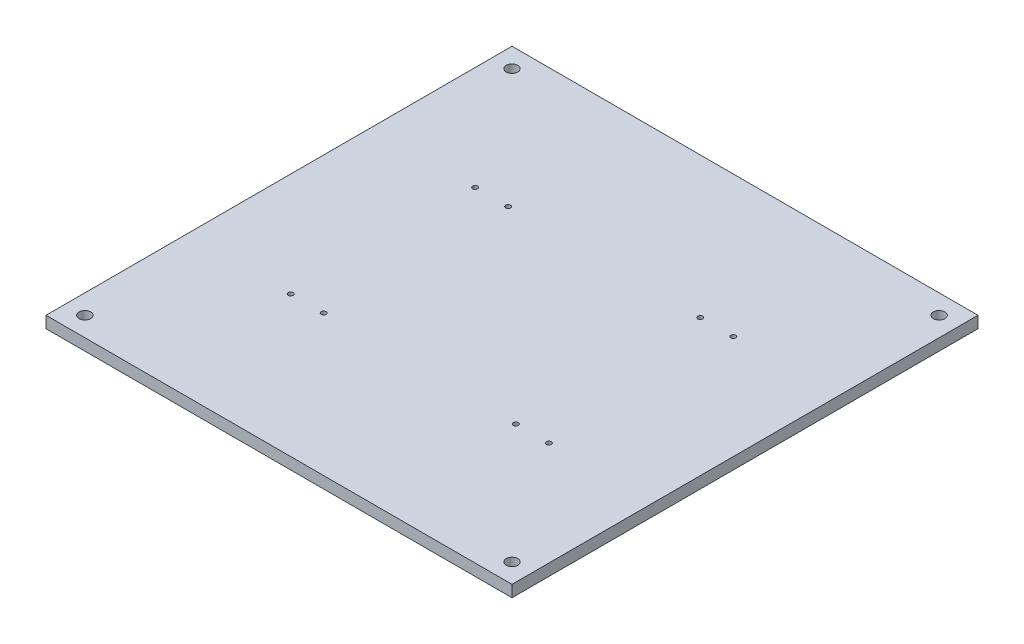
from build123d import *

# Parameters (mm, degrees)
EXTRUDE_1_DEPTH    = 6
SKETCH2_R          = 1.25
SKETCH2_R_2        = 3
CUT_EXTRUDE1_DEPTH = 170.811660377


with BuildPart() as part:
    # 草图1 → 凸台-拉伸1 (new body)
    with BuildSketch(Plane(origin=(0, 0, 0), x_dir=(1, 0, 0), z_dir=(0, 1, 0))):
        Polygon((-120, 118), (-120, 120), (-118, 120), (118, 120), (120, 120), (120, 118), (120, -118), (120, -120), (118, -120), (-118, -120), (-120, -120), (-120, -118), align=None)
    extrude(amount=-EXTRUDE_1_DEPTH)

    # Sketch2 → Cut-Extrude1 (cut, through all)
    with BuildSketch(Plane.XZ.offset(6)):
        with Locations((-66.5, 47.5)):
            Circle(SKETCH2_R)
        with Locations((-49.5, 47.5)):
            Circle(SKETCH2_R)
        with Locations((-66.5, -47.5)):
            Circle(SKETCH2_R)
        with Locations((-49.5, -47.5)):
            Circle(SKETCH2_R)
        with Locations((49.5, -47.5)):
            Circle(SKETCH2_R)
        with Locations((66.5, -47.5)):
            Circle(SKETCH2_R)
        with Locations((49.5, 47.5)):
            Circle(SKETCH2_R)
        with Locations((66.5, 47.5)):
            Circle(SKETCH2_R)
        with Locations((-110, 110)):
            Circle(SKETCH2_R_2)
        with Locations((110, 110)):
            Circle(SKETCH2_R_2)
        with Locations((-110, -110)):
            Circle(SKETCH2_R_2)
        with Locations((110, -110)):
            Circle(SKETCH2_R_2)
    extrude(amount=-CUT_EXTRUDE1_DEPTH, mode=Mode.SUBTRACT)


solid = part.part
